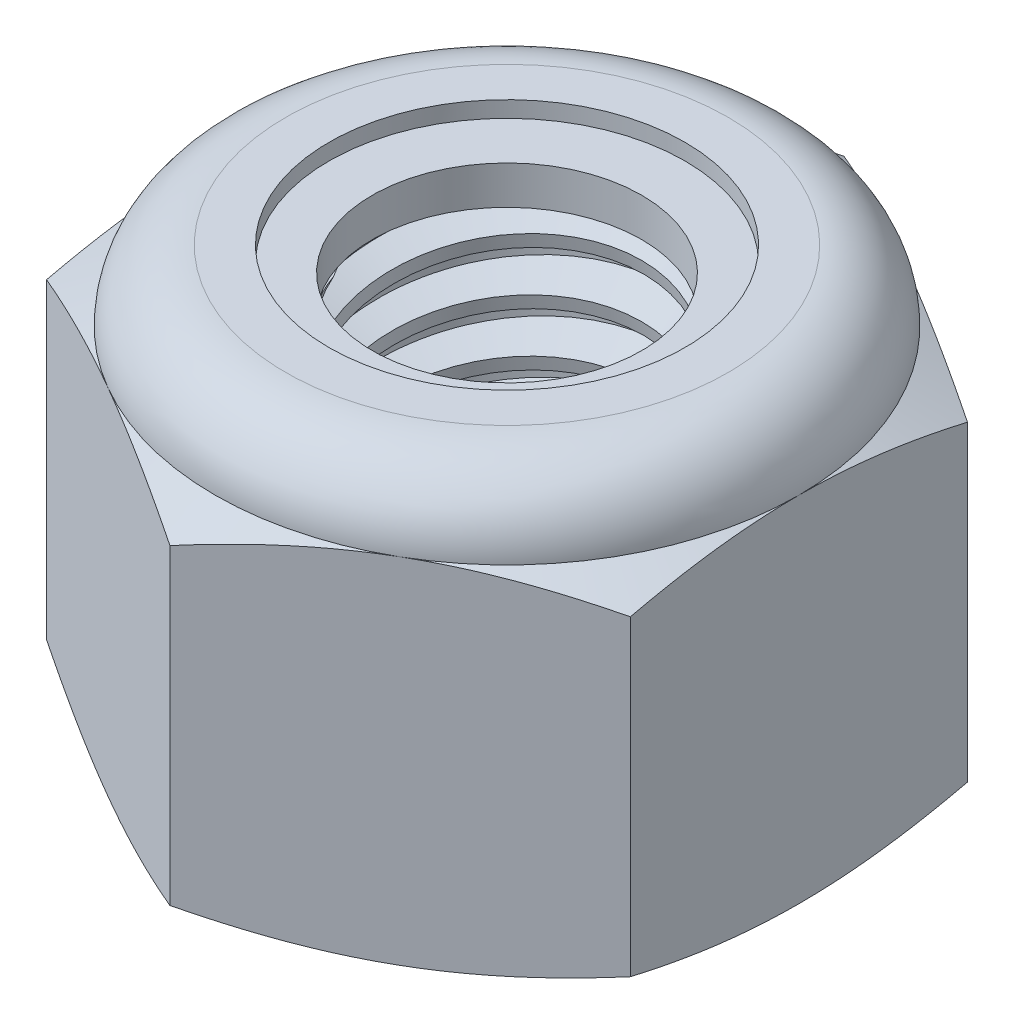
from build123d import *

# Parameters (mm, degrees)
EXTRUDE1_DEPTH       = 4
SKETCH2_W            = 1.5
SKETCH2_H            = 4
LPATTERN1_COUNT      = 8
LPATTERN1_PITCH      = 0.5
LPATTERN1_COUNT_DIR2 = 2
LPATTERN1_PITCH_DIR2 = 0.5


with BuildPart() as part:
    # Sketch1 → Extrude1 (new body)
    with BuildSketch(Plane(origin=(0, 0, 0), x_dir=(1, 0, 0), z_dir=(0, 1, 0))):
        Polygon((0, 3.175426481), (-2.75, 1.58771324), (-2.75, -1.58771324), (0, -3.175426481), (2.75, -1.58771324), (2.75, 1.58771324), align=None)
    extrude(amount=EXTRUDE1_DEPTH)

    # Sketch4 → Cut-Revolve2 (revolve, cut)
    with BuildSketch(Plane(origin=(0, 0, 0), x_dir=(0, 0, -1), z_dir=(1, 0, 0))):
        Polygon((0, 4), (1.5, 4), (1.269011592, 3.892288336), (1.269011592, 0.107711664), (1.5, 0), (0, 0), align=None)
    revolve(axis=Axis((0, 4, 0), (0, 1, 0)), mode=Mode.SUBTRACT)


with BuildPart() as body_2:
    # Sketch2 → Revolve1 (revolve)
    with BuildSketch(Plane(origin=(0, 0, 0), x_dir=(0, 0, -1), z_dir=(1, 0, 0))):
        with Locations((0.75, 2)):
            Rectangle(SKETCH2_W, SKETCH2_H)
    revolve(axis=Axis((0, -1.5, 0), (0, 1, 0)))

    # Sketch3 → Cut-Revolve1 (revolve, cut)
    with BuildSketch(Plane(origin=(0, 0, 0), x_dir=(0, 0, -1), z_dir=(1, 0, 0))):
        Polygon((1.510274937, 3.93835038), (1.582199494, 3.506803038), (1.289561466, 3.616435308), (1.269011592, 3.739734548), align=None)
    cut_revolve1 = revolve(axis=Axis((0, 4, 0.089188249), (0, -0.9863939238321437, -0.1643989873053575)), mode=Mode.SUBTRACT)

    # LPattern1: Cut-Revolve1 8 × 2
    with Locations(*[Vector(0, -1, 0) * (i * LPATTERN1_PITCH) + Vector(0, 1, 0) * (j * LPATTERN1_PITCH_DIR2) for i in range(LPATTERN1_COUNT) for j in range(LPATTERN1_COUNT_DIR2) if (i, j) != (0, 0)]):
        add(cut_revolve1, mode=Mode.SUBTRACT)


with BuildPart() as part_1:
    add(part.part)

    # Combine1: cut body 2
    add(body_2.part, mode=Mode.SUBTRACT)

    # Sketch5 → Cut-Revolve3 (revolve, cut)
    with BuildSketch(Plane(origin=(0, 0, 0), x_dir=(0, 0, -1), z_dir=(1, 0, 0))):
        with BuildLine():
            Line((0, 0), (2.75, 0))
            Line((2.75, 0), (3.175426481, 0.198379626))
            Line((3.175426481, 0.198379626), (3.175426481, 3.134953707))
            Line((3.175426481, 3.134953707), (2.75, 3.333333333))
            ThreePointArc((2.75, 3.333333333), (2.554737854, 3.804737854), (2.083333333, 4))
            Line((2.083333333, 4), (2.083333333, 5.27))
            Line((2.083333333, 5.27), (4.445426481, 5.27))
            Line((4.445426481, 5.27), (4.445426481, -1.27))
            Line((4.445426481, -1.27), (0, -1.27))
            Line((0, -1.27), (0, 0))
        make_face()
    revolve(axis=Axis((0, 0, 0), (0, 1, 0)), mode=Mode.SUBTRACT)

    # Sketch6 → Cut-Revolve4 (revolve, cut)
    with BuildSketch(Plane(origin=(0, 0, 0), x_dir=(0, 0, -1), z_dir=(1, 0, 0))):
        with BuildLine():
            Line((0, 3.333333333), (2.5976, 3.333333333))
            ThreePointArc((2.5976, 3.333333333), (2.446974781, 3.696974781), (2.083333333, 3.8476))
            Line((2.083333333, 3.8476), (1.676172463, 3.8476))
            Line((1.676172463, 3.8476), (1.676172463, 5.27))
            Line((1.676172463, 5.27), (0, 5.27))
            Line((0, 5.27), (0, 3.333333333))
        make_face()
    revolve(axis=Axis((0, 5.27, 0), (0, 1, 0)), mode=Mode.SUBTRACT)


with BuildPart() as body_2_2:
    # Sketch7 → Revolve2 (revolve)
    with BuildSketch(Plane(origin=(0, 0, 0), x_dir=(0, 0, -1), z_dir=(1, 0, 0))):
        with BuildLine():
            Line((1.269011592, 3.409533333), (2.514721748, 3.409533333))
            ThreePointArc((2.514721748, 3.409533333), (2.36486639, 3.668954462), (2.083333333, 3.7714))
            Line((2.083333333, 3.7714), (1.269011592, 3.7714))
            Line((1.269011592, 3.7714), (1.269011592, 3.409533333))
        make_face()
    revolve(axis=Axis((0, 3.409533333, 0), (0, 1, 0)))


solid = Compound([part_1.part, body_2_2.part])
